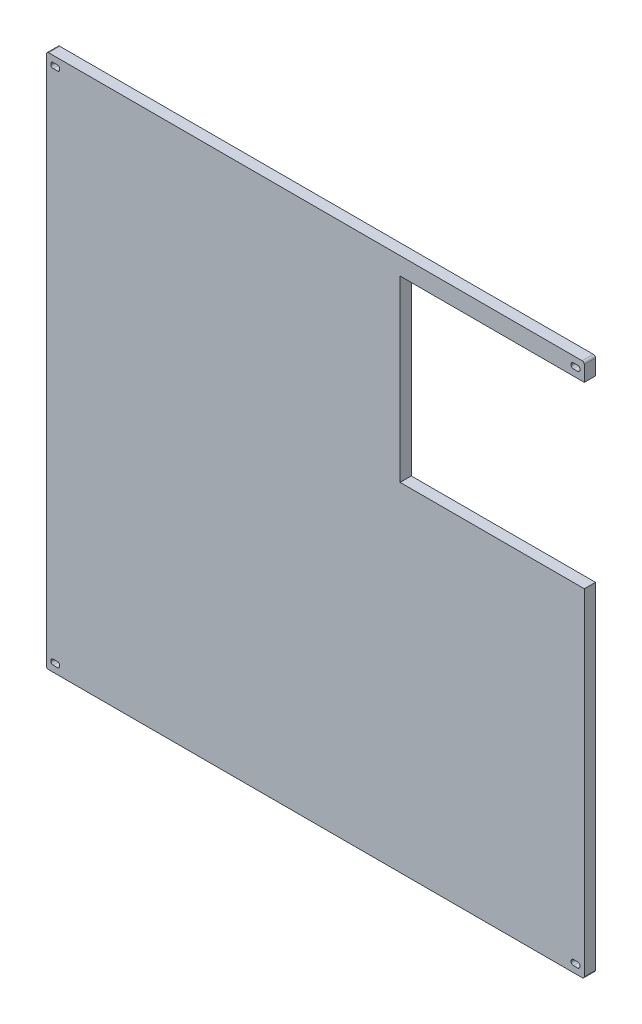
from build123d import *

# Parameters (mm, degrees)
BOSS_EXTRUDE2_DEPTH = 12.7
FILLET2_R           = 2.5


with BuildPart() as part:
    # Sketch1 → Boss-Extrude2 (new body)
    with BuildSketch(Plane.XY):
        Polygon((0, 0), (-611.632, 0), (-611.632, 607.568), (0, 607.568), (0, 587.480907233), (-209.519092864, 587.480907233), (-209.519092864, 384.280907233), (0, 384.280907233), align=None)
        with BuildLine():
            Line((-5, 10.5), (-5, 9.5))
            ThreePointArc((-5, 9.5), (-5.732233047, 7.732233047), (-7.5, 7))
            Line((-7.5, 7), (-12.5, 7))
            ThreePointArc((-12.5, 7), (-14.267766953, 7.732233047), (-15, 9.5))
            Line((-15, 9.5), (-15, 10.5))
            ThreePointArc((-15, 10.5), (-14.267766953, 12.267766953), (-12.5, 13))
            Line((-12.5, 13), (-7.5, 13))
            ThreePointArc((-7.5, 13), (-5.732233047, 12.267766953), (-5, 10.5))
        make_face(mode=Mode.SUBTRACT)
        with BuildLine():
            Line((-596.63, 10.5), (-596.63, 9.5))
            ThreePointArc((-596.63, 9.5), (-597.362233047, 7.732233047), (-599.13, 7))
            Line((-599.13, 7), (-604.13, 7))
            ThreePointArc((-604.13, 7), (-605.897766953, 7.732233047), (-606.63, 9.5))
            Line((-606.63, 9.5), (-606.63, 10.5))
            ThreePointArc((-606.63, 10.5), (-605.897766953, 12.267766953), (-604.13, 13))
            Line((-604.13, 13), (-599.13, 13))
            ThreePointArc((-599.13, 13), (-597.362233047, 12.267766953), (-596.63, 10.5))
        make_face(mode=Mode.SUBTRACT)
        with BuildLine():
            Line((-596.63, 598.07), (-596.63, 597.07))
            ThreePointArc((-596.63, 597.07), (-597.362233047, 595.302233047), (-599.13, 594.57))
            Line((-599.13, 594.57), (-604.13, 594.57))
            ThreePointArc((-604.13, 594.57), (-605.897766953, 595.302233047), (-606.63, 597.07))
            Line((-606.63, 597.07), (-606.63, 598.07))
            ThreePointArc((-606.63, 598.07), (-605.897766953, 599.837766953), (-604.13, 600.57))
            Line((-604.13, 600.57), (-599.13, 600.57))
            ThreePointArc((-599.13, 600.57), (-597.362233047, 599.837766953), (-596.63, 598.07))
        make_face(mode=Mode.SUBTRACT)
        with BuildLine():
            Line((-5, 598.07), (-5, 597.07))
            ThreePointArc((-5, 597.07), (-5.732233047, 595.302233047), (-7.5, 594.57))
            Line((-7.5, 594.57), (-12.5, 594.57))
            ThreePointArc((-12.5, 594.57), (-14.267766953, 595.302233047), (-15, 597.07))
            Line((-15, 597.07), (-15, 598.07))
            ThreePointArc((-15, 598.07), (-14.267766953, 599.837766953), (-12.5, 600.57))
            Line((-12.5, 600.57), (-7.5, 600.57))
            ThreePointArc((-7.5, 600.57), (-5.732233047, 599.837766953), (-5, 598.07))
        make_face(mode=Mode.SUBTRACT)
    extrude(amount=BOSS_EXTRUDE2_DEPTH)

    # Fillet2
    fillet2_edges = [part.edges().sort_by_distance(p)[0] for p in [
        (-611.632, 0, 6.35),
        (0, 0, 6.35),
        (-611.632, 607.568, 6.35),
        (0, 607.568, 6.35),
    ]]
    fillet(fillet2_edges, radius=FILLET2_R)


solid = part.part
